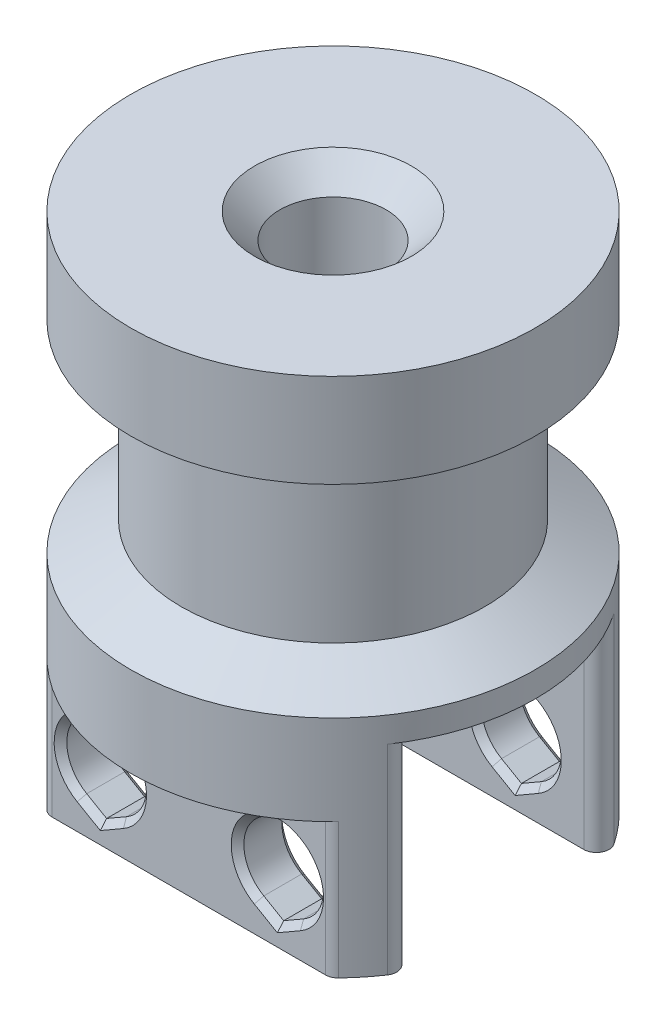
from build123d import *

# Parameters (mm, degrees)
CHAMFER1_SIZE           = 3.464101615
CHAMFER1_SIZE_2         = 2
CHAMFER3_SIZE           = 1
BOSS_EXTRUDE1_START     = -41.474989169
BOSS_EXTRUDE1_OUTLINE_R = 8
BOSS_EXTRUDE1_DEPTH     = 7.9
SKETCH1_4_R             = 1.5749999999999995
CUT_EXTRUDE1_DEPTH      = 3.7
CUT_EXTRUDE3_DEPTH      = 58.66491382432064
CUT_EXTRUDE3_DEPTH_BACK = 58.66491382432064
SKETCH1_6_R             = 1.5749999999999995
CUT_EXTRUDE2_START      = -5.7
CUT_EXTRUDE2_DEPTH      = 52.964913909989384
FILLET2_R               = 0.5
CHAMFER4_SIZE           = 0.25


# Read off the part's stored shape, not the designer's step: Boss-Extrude1
with BuildPart() as part:
    # Sketch1 → Revolve1 (revolve)
    with BuildSketch(Plane.XY, mode=Mode.PRIVATE) as revolve1_sk:
        Polygon((33.35643335515833, -33.57498916935771), (33.35643335515833, -20.874989169357704), (39.256433355158336, -20.87498916935769), (39.256433355158336, -24.574989169357693), (37.25643335515833, -24.574989169357696), (37.256433355158336, -30.5749891693577), (39.256433355158336, -30.5749891693577), (39.256433355158336, -33.5749891693577), align=None)
    revolve(revolve1_sk.sketch.rotate(Axis((31.256433355158332, 2.6543833262093552, 0), (0, -1, 0)), 90), axis=Axis((31.256433355158332, 2.6543833262093552, 0), (0, -1, 0)))

    # Chamfer1
    # the kernel refuses this chamfer: 3.464101615, 2 mm, written as the material it takes off along each edge
    with BuildSketch(Plane(origin=(31.256433355158332, -30.5749891693577, 0), x_dir=(0, 0, 1), z_dir=(1, 0, 0))) as chamfer1_piece_1_section:
        Polygon((8.000000000000004 - CHAMFER1_SIZE, 0), (8.000000000000004, CHAMFER1_SIZE_2), (8.000000000000004, 0), align=None)
    chamfer1_piece_1 = revolve(axis=Axis((31.256433355158332, -30.5749891693577, 0), (0, -1, 0)), mode=Mode.PRIVATE)
    chamfer1_piece_1 = chamfer1_piece_1 - Plane(origin=(31.256433355158332, -31.987048934544962, 0), x_dir=(0, 0, 1), z_dir=(0, -1, 0)) * Cylinder(5.9999999999999964, 33, mode=Mode.PRIVATE)
    add(chamfer1_piece_1, mode=Mode.SUBTRACT)

    # Chamfer3
    chamfer3_edges = [part.edges().sort_by_distance(p)[0] for p in [
        (31.256433355158332, -20.874989169357704, -2.099999999999998),
    ]]
    chamfer(chamfer3_edges, length=CHAMFER3_SIZE)

    # Boss-Extrude1 outline → Boss-Extrude1 (add)
    with BuildSketch(Plane(origin=(0, 0, 0), x_dir=(1, 0, 0), z_dir=(0, 1, 0)).offset(BOSS_EXTRUDE1_START)):
        with Locations((31.256433355, 0)):
            Circle(BOSS_EXTRUDE1_OUTLINE_R)
    extrude(amount=BOSS_EXTRUDE1_DEPTH)

    # Sketch1<4> → Cut-Extrude1 (cut, symmetric)
    # profile 1 of 7: a face of its own
    with BuildSketch(Plane.XY):
        Polygon((39.25643335515834, -41.47498916935769), (39.25643335515834, -36.1249891693577), (23.256433355158325, -36.12498916935768), (23.256433355158325, -41.47498916935769), align=None)
        with BuildLine():
            Line((27.75643335515833, -40.69364251730501), (26.968933355158327, -40.23897918031817))
            ThreePointArc((26.968933355158327, -40.23897918031817), (26.96893335515834, -37.51099915839719), (29.331433355158335, -38.87498916935768))
            ThreePointArc((29.331433355158335, -38.87498916935768), (29.120423366118825, -39.662489169357684), (28.543933355158334, -40.238979180318175))
            Line((28.543933355158334, -40.238979180318175), (27.75643335515833, -40.69364251730501))
        make_face(mode=Mode.SUBTRACT)
        with BuildLine():
            Line((34.75643335515833, -40.69364251730501), (33.968933355158335, -40.238979180318175))
            ThreePointArc((33.968933355158335, -40.238979180318175), (33.96893335515833, -37.5109991583972), (36.33143335515833, -38.87498916935768))
            ThreePointArc((36.33143335515833, -38.87498916935768), (36.12042336611882, -39.662489169357684), (35.54393335515832, -40.238979180318175))
            Line((35.54393335515833, -40.23897918031818), (34.75643335515833, -40.69364251730501))
        make_face(mode=Mode.SUBTRACT)
    # profile 2 of 7: a face of its own
    with BuildSketch(Plane.XY):
        with Locations((27.756433355158336, -38.87498916935768)):
            Circle(SKETCH1_4_R)
    # profile 3 of 7: a face of its own
    with BuildSketch(Plane.XY):
        with Locations((34.75643335515833, -38.87498916935768)):
            Circle(SKETCH1_4_R)
    # profile 4 of 7: a face of its own
    with BuildSketch(Plane.XY):
        with BuildLine():
            ThreePointArc((35.54393335515832, -40.238979180318175), (34.75643335515833, -40.449989169357686), (33.968933355158335, -40.238979180318175))
            Line((33.968933355158335, -40.238979180318175), (34.75643335515833, -40.69364251730501))
            Line((34.75643335515833, -40.69364251730501), (35.54393335515833, -40.23897918031818))
        make_face()
    # profile 5 of 7: a face of its own
    with BuildSketch(Plane.XY):
        with BuildLine():
            ThreePointArc((28.543933355158334, -40.238979180318175), (27.75643335515833, -40.449989169357686), (26.968933355158327, -40.23897918031817))
            Line((26.968933355158327, -40.23897918031817), (27.75643335515833, -40.69364251730501))
            Line((27.75643335515833, -40.69364251730501), (28.543933355158334, -40.238979180318175))
        make_face()
    # profile 6 of 7: a face of its own
    with BuildSketch(Plane.XY):
        Polygon((33.35643335515833, -33.57498916935771), (23.256433355158332, -33.5749891693577), (23.256433355158325, -35.87498916935769), (39.25643335515834, -35.87498916935769), (39.256433355158336, -33.5749891693577), align=None)
    # profile 7 of 7: a face of its own
    with BuildSketch(Plane.XY):
        Polygon((39.25643335515834, -36.1249891693577), (39.25643335515834, -35.87498916935769), (23.256433355158325, -35.87498916935769), (23.256433355158325, -36.12498916935768), align=None)
    extrude(amount=CUT_EXTRUDE1_DEPTH, both=True, mode=Mode.SUBTRACT)

    # Sketch1<6> → Cut-Extrude3 (cut, two sides: drawn at the far end of the back side and taken through both)
    with BuildSketch(Plane.XY.offset(-CUT_EXTRUDE3_DEPTH_BACK)):
        with Locations((27.756433355158336, -38.87498916935768)):
            Circle(SKETCH1_6_R)
        with BuildLine():
            ThreePointArc((28.543933355158334, -40.238979180318175), (27.75643335515833, -40.449989169357686), (26.968933355158327, -40.23897918031817))
            Line((26.968933355158327, -40.23897918031817), (27.75643335515833, -40.69364251730501))
            Line((27.75643335515833, -40.69364251730501), (28.543933355158334, -40.238979180318175))
        make_face()
        with BuildLine():
            ThreePointArc((35.54393335515832, -40.238979180318175), (34.75643335515833, -40.449989169357686), (33.968933355158335, -40.238979180318175))
            Line((33.968933355158335, -40.238979180318175), (34.75643335515833, -40.69364251730501))
            Line((34.75643335515833, -40.69364251730501), (35.54393335515833, -40.23897918031818))
        make_face()
        with Locations((34.75643335515833, -38.87498916935768)):
            Circle(SKETCH1_6_R)
    extrude(amount=CUT_EXTRUDE3_DEPTH + CUT_EXTRUDE3_DEPTH_BACK, mode=Mode.SUBTRACT)

    # Sketch1<5> → Cut-Extrude2 (cut, through all)
    with BuildSketch(Plane.XY.offset(CUT_EXTRUDE2_START)):
        Polygon((39.25643335515834, -41.47498916935769), (39.25643335515834, -36.1249891693577), (23.256433355158325, -36.12498916935768), (23.256433355158325, -41.47498916935769), align=None)
        with BuildLine():
            Line((27.75643335515833, -40.69364251730501), (26.968933355158327, -40.23897918031817))
            ThreePointArc((26.968933355158327, -40.23897918031817), (26.96893335515834, -37.51099915839719), (29.331433355158335, -38.87498916935768))
            ThreePointArc((29.331433355158335, -38.87498916935768), (29.120423366118825, -39.662489169357684), (28.543933355158334, -40.238979180318175))
            Line((28.543933355158334, -40.238979180318175), (27.75643335515833, -40.69364251730501))
        make_face(mode=Mode.SUBTRACT)
        with BuildLine():
            Line((34.75643335515833, -40.69364251730501), (33.968933355158335, -40.238979180318175))
            ThreePointArc((33.968933355158335, -40.238979180318175), (33.96893335515833, -37.5109991583972), (36.33143335515833, -38.87498916935768))
            ThreePointArc((36.33143335515833, -38.87498916935768), (36.12042336611882, -39.662489169357684), (35.54393335515832, -40.238979180318175))
            Line((35.54393335515833, -40.23897918031818), (34.75643335515833, -40.69364251730501))
        make_face(mode=Mode.SUBTRACT)
    cut_extrude2 = extrude(amount=-CUT_EXTRUDE2_DEPTH, mode=Mode.SUBTRACT)

    # Mirror2: Cut-Extrude2 across plane
    add(cut_extrude2.mirror(Plane.XY), mode=Mode.SUBTRACT)

    # Fillet2
    # the kernel refuses this fillet: 0.5 mm, written as the material it takes off along each edge
    with BuildSketch(Plane(origin=(36.86981023527447, -36.1249891693577, -5.7), x_dir=(0.7029804888308749, 0, 0.7112091340267671), z_dir=(0, -1, 0))) as fillet2_piece_1:
        with BuildLine():
            CenterArc((0.2088579287890988, 0.4999546060201171), FILLET2_R, 224.66662086027418, 46.10544623611554)
            Line((-0.14674663822282122, 0.14846436160319898), (0, 0))
            ThreePointArc((0, 0), (0.10779764066534617, -0.00072630367813129), (0.21559528133068703, -1e-17))
        make_face()
    extrude(amount=5.888988203147861, mode=Mode.SUBTRACT)
    with BuildSketch(Plane(origin=(25.643056474725523, -36.12498916935768, -5.7), x_dir=(-0.702980488830873, 0, 0.7112091340267691), z_dir=(0, -1, 0))) as fillet2_piece_2:
        with BuildLine():
            CenterArc((0.20885792878910586, -0.49995460602011715), FILLET2_R, 89.22793290361042, 46.10544623611679)
            Line((-0.14674663822282266, -0.14846436160320758), (0, 0))
            ThreePointArc((0, 0), (0.10779764066534558, 0.00072630367812718), (0.21559528133069272, 1e-17))
        make_face()
    extrude(amount=5.888988203147889, mode=Mode.SUBTRACT)
    with BuildSketch(Plane(origin=(25.643056474725523, -36.12498916935768, 5.7), x_dir=(1, 0, 0), z_dir=(0, -1, 0))) as fillet2_piece_3:
        with BuildLine():
            CenterArc((0.20874923352183217, -0.5), FILLET2_R, 90, 46.10544623635468)
            ThreePointArc((-0.15155927626154408, -0.1533333333334701), (-0.07629619193971493, -0.07615608935305396), (0, 0))
            Line((0, 0), (0.20874923352183217, 0))
        make_face()
    extrude(amount=5.888988203147981, mode=Mode.SUBTRACT)
    with BuildSketch(Plane(origin=(36.86981023527447, -36.1249891693577, 5.7), x_dir=(-1, 0, 0), z_dir=(0, -1, 0))) as fillet2_piece_4:
        with BuildLine():
            CenterArc((0.2087492335218215, 0.5), FILLET2_R, 223.8945537636461, 46.10544623635394)
            ThreePointArc((-0.1515592762615512, 0.15333333333346388), (-0.07629619193971138, 0.07615608935304952), (0, 0))
            Line((0, 0), (0.2087492335218215, 0))
        make_face()
    extrude(amount=5.888988203147967, mode=Mode.SUBTRACT)
    with BuildSketch(Plane(origin=(38.34938760552213, -33.5749891693577, 3.7), x_dir=(-1, 0, 0), z_dir=(0, -1, 0))) as fillet2_piece_5:
        with BuildLine():
            CenterArc((0.8792596973597355, -0.5), FILLET2_R, 90, 124.05579774256802)
            ThreePointArc((0.4650133938155747, -0.780000000000002), (0.22143035578866233, -0.3966033935575206), (0, 0))
            Line((0, 0), (0.8792596973597355, 0))
        make_face()
    extrude(amount=10.170238776398236, mode=Mode.SUBTRACT)
    with BuildSketch(Plane(origin=(24.163479104477865, -33.5749891693577, 3.7), x_dir=(1, 0, 0), z_dir=(0, -1, 0))) as fillet2_piece_6:
        with BuildLine():
            CenterArc((0.8792596973597426, 0.5), FILLET2_R, 145.94420225743224, 124.05579774256776)
            ThreePointArc((0.4650133938155818, 0.7799999999999994), (0.22143035578866233, 0.3966033935575153), (0, 0))
            Line((0, 0), (0.8792596973597426, 0))
        make_face()
    extrude(amount=10.170238776398243, mode=Mode.SUBTRACT)
    with BuildSketch(Plane(origin=(38.34938760552213, -33.5749891693577, -3.7), x_dir=(-0.512075424194691, 0, -0.858940486841683), z_dir=(0, -1, 0))) as fillet2_piece_7:
        with BuildLine():
            CenterArc((0.8797175259236281, -0.4991940404131022), FILLET2_R, 86.74637410845834, 124.05579774256779)
            Line((0.4502472825027866, -0.7552317525104477), (0, 0))
            ThreePointArc((0, 0), (0.4540477553154187, 0.01289535339037927), (0.9080955106308399, 1e-17))
        make_face()
    extrude(amount=10.170238776398243, mode=Mode.SUBTRACT)
    with BuildSketch(Plane(origin=(24.163479104477865, -33.5749891693577, -3.7), x_dir=(0.512075424194691, 0, -0.858940486841683), z_dir=(0, -1, 0))) as fillet2_piece_8:
        with BuildLine():
            CenterArc((0.8797175259236281, 0.4991940404131022), FILLET2_R, 149.1978281489743, 124.05579774256734)
            Line((0.4502472825027848, 0.7552317525104447), (0, 0))
            ThreePointArc((0, 0), (0.4540477553154179, -0.01289535339037882), (0.9080955106308399, -1e-17))
        make_face()
    extrude(amount=10.170238776398243, mode=Mode.SUBTRACT)

    # Chamfer4
    chamfer4_edges = [part.edges().sort_by_distance(p)[0] for p in [
        (34.36268335515833, -40.46631084881159, -3.7),
        (34.75643335515833, -37.29998916935768, -3.7),
        (27.75643335515833, -37.29998916935768, -5.7),
        (27.362683355158328, -40.46631084881159, -5.7),
        (34.75643335515834, -37.299989169357694, -5.7),
        (34.36268335515833, -40.46631084881159, -5.7),
        (28.150183355158333, -40.46631084881159, -5.7),
        (35.15018335515833, -40.466310848811595, -5.7),
        (34.75643335515834, -37.2999891693577, 5.7),
        (34.36268335515833, -40.46631084881159, 5.7),
        (35.15018335515833, -40.466310848811595, 5.7),
        (27.75643335515833, -37.29998916935768, 5.7),
        (27.362683355158328, -40.46631084881159, 5.7),
        (28.150183355158333, -40.46631084881159, 5.7),
        (34.75643335515833, -37.29998916935768, 3.7),
        (34.36268335515833, -40.46631084881159, 3.7),
        (35.15018335515833, -40.4663108488116, 3.7000000000000006),
        (27.362683355158328, -40.46631084881159, 3.7),
        (28.15018335515833, -40.46631084881159, 3.7),
        (27.75643335515834, -37.29998916935768, 3.7),
        (27.75643335515834, -37.29998916935768, -3.7),
        (28.15018335515833, -40.46631084881159, -3.7),
        (27.362683355158328, -40.46631084881159, -3.7),
        (35.15018335515833, -40.4663108488116, -3.7000000000000006),
    ]]
    chamfer(chamfer4_edges, length=CHAMFER4_SIZE)


solid = part.part
